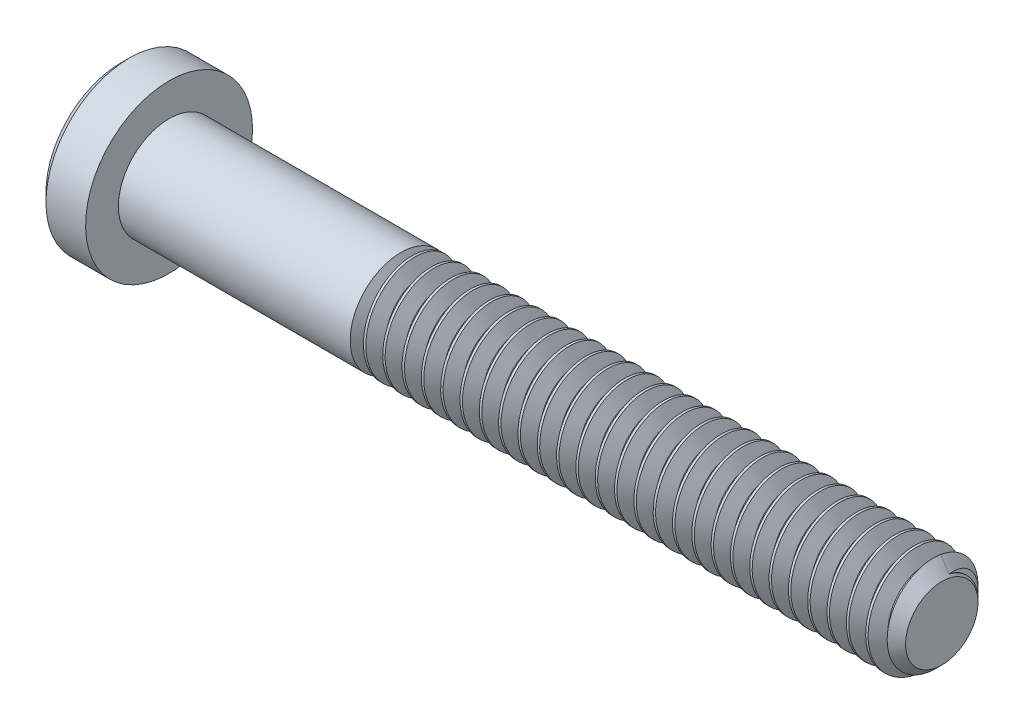
from build123d import *

# Parameters (mm, degrees)
SKETCH2_R           = 2.0828
BOSS_EXTRUDE1_DEPTH = 22.225
CHAMFER1_SIZE       = 0.5953125
CUT_SWEEP1_PITCH    = 0.79375
CUT_EXTRUDE1_DEPTH  = 1.524


with BuildPart() as part:
    # Sketch2 → Boss-Extrude1 (new body)
    with BuildSketch(Plane(origin=(15.875, 0, 0), x_dir=(0, 0, -1), z_dir=(1, 0, 0))):
        Circle(SKETCH2_R)
    extrude(amount=-BOSS_EXTRUDE1_DEPTH)

    # Chamfer1
    chamfer1_edges = [part.edges().sort_by_distance(p)[0] for p in [
        (15.875, 0, 2.0828),
    ]]
    chamfer(chamfer1_edges, length=CHAMFER1_SIZE)

    # Cut-Sweep1: the profile of Sketch5 profile screwed along a right-hand helix of 29 turns, 8 arcs to a turn; built about Z, then put on its axis
    cut_sweep1_z = Axis((0, 0, 0), (0, 0, 1))
    cut_sweep1_corners = [(2.0831, 0, 0.34743883), (2.0831, 0, -0.34743883), (1.567244252, 0, -0.049609375), (1.567244252, 0, 0.049609375)]
    with BuildLine(mode=Mode.PRIVATE) as cut_sweep1_profile:
        Line(cut_sweep1_corners[0], cut_sweep1_corners[1])
        Line(cut_sweep1_corners[1], cut_sweep1_corners[2])
        Line(cut_sweep1_corners[2], cut_sweep1_corners[3])
        Line(cut_sweep1_corners[3], cut_sweep1_corners[0])
    cut_sweep1_cap = Face(cut_sweep1_profile.wire())
    cut_sweep1_turn_angles = [0, 22.5, 45, 67.5, 90, 112.5, 135, 157.5, 180, 202.5, 225, 247.5, 270, 292.5, 315, 337.5, 360]
    cut_sweep1_turn_weights = [1, 0.9238795325112867, 1, 0.9238795325112867, 1, 0.9238795325112867, 1, 0.9238795325112867, 1, 0.9238795325112867, 1, 0.9238795325112867, 1, 0.9238795325112867, 1, 0.9238795325112867, 1]
    cut_sweep1_turn_rails = [Edge.make_bspline([Vector(p[0], p[1], 0).rotate(cut_sweep1_z, cut_sweep1_turn_angles[k]) / cut_sweep1_turn_weights[k] + Vector(0, 0, p[2] + CUT_SWEEP1_PITCH * cut_sweep1_turn_angles[k] / 360) for k in range(17)], [0, 0, 0, 1, 1, 2, 2, 3, 3, 4, 4, 5, 5, 6, 6, 7, 7, 8, 8, 8], 2, cut_sweep1_turn_weights) for p in cut_sweep1_corners]
    cut_sweep1_turn_sides = [Face.make_surface_from_curves(cut_sweep1_turn_rails[p[0]], cut_sweep1_turn_rails[p[1]]) for p in [(0, 1), (1, 2), (2, 3), (3, 0)]]
    cut_sweep1 = Plane(origin=(15.875, 0, 0), x_dir=(0, 1, 0), z_dir=(-1, 0, 0)) * Solid(Shell([*[p.moved(Location((0, 0, CUT_SWEEP1_PITCH * i))) for i in range(29) for p in cut_sweep1_turn_sides], cut_sweep1_cap, cut_sweep1_cap.rotate(cut_sweep1_z, 10440).moved(Location((0, 0, CUT_SWEEP1_PITCH * 10440 / 360)))]))
    add(cut_sweep1, mode=Mode.SUBTRACT)

    # Sketch9 → Revolve2 (revolve)
    with BuildSketch(Plane.XY, mode=Mode.PRIVATE) as revolve2_sk:
        Polygon((-15.875, 0), (-15.875, 2.0828), (-6.35, 2.0828), (-5.147494859, 0), align=None)
    revolve(revolve2_sk.sketch.rotate(Axis((-15.875, 0, 0), (1, 0, 0)), 292.5), axis=Axis((-15.875, 0, 0), (1, 0, 0)))

    # Sketch6 → Revolve1 (revolve)
    with BuildSketch(Plane.XY, mode=Mode.PRIVATE) as revolve1_sk:
        Polygon((-17.503775, 3.429), (-17.859375, 3.0734), (-17.859375, 0), (-15.875, 0), (-15.875, 3.429), align=None)
    revolve(revolve1_sk.sketch.rotate(Axis((-15.875, 0, 0), (-1, 0, 0)), 67.5), axis=Axis((-15.875, 0, 0), (-1, 0, 0)))

    # Sketch4 → Cut-Extrude1 (cut)
    with BuildSketch(Plane(origin=(-17.859375, 0, 0), x_dir=(0, 0, -1), z_dir=(1, 0, 0))):
        Polygon((0, 1.14567944), (-0.9921875, 0.57283972), (-0.9921875, -0.57283972), (0, -1.14567944), (0.9921875, -0.57283972), (0.9921875, 0.57283972), align=None)
    extrude(amount=CUT_EXTRUDE1_DEPTH, mode=Mode.SUBTRACT)

    # Cut-Extrude2 cone 1 section (through the dimple's axis) → Cut-Extrude2 (revolve, cut)
    with BuildSketch(Plane(origin=(-17.859375, 0, 0), x_dir=(0, 0, 1), z_dir=(0, 1, 0))):
        Polygon((0, 0), (1.14567944, 0), (0, 1.14567944), align=None)
    revolve(axis=Axis((-17.859375, 0, 0), (1, 0, 0)), mode=Mode.SUBTRACT)


solid = part.part
